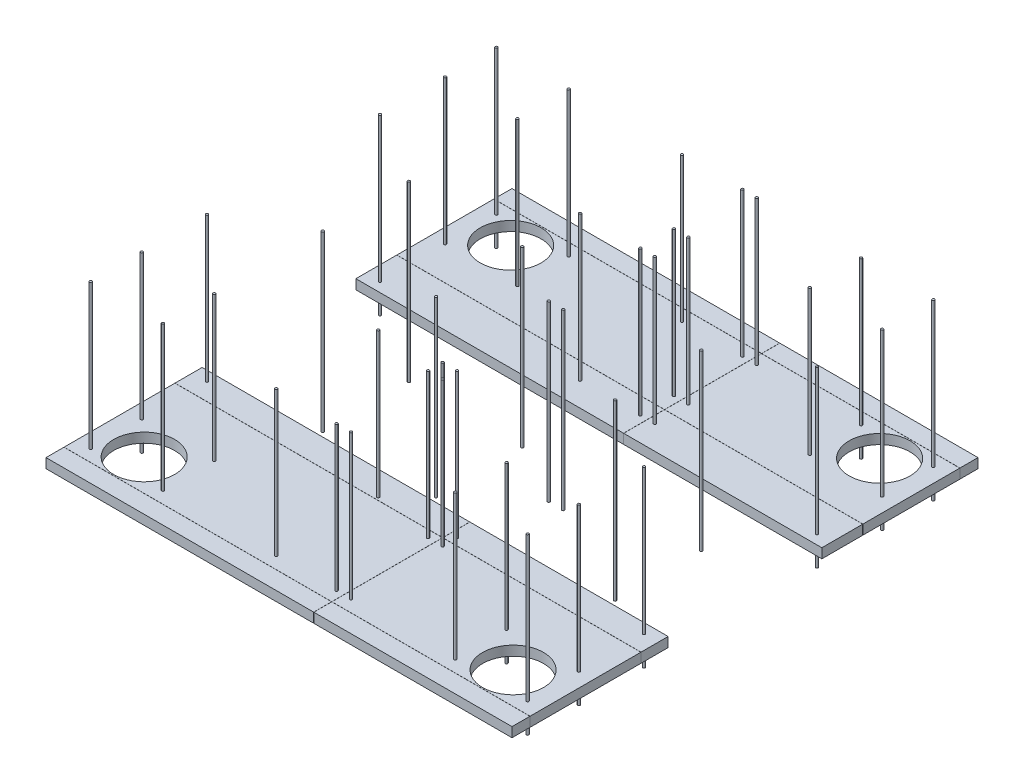
from build123d import *

# Parameters (mm, degrees)
SKETCH1_W                          = 4908.55
SKETCH1_H                          = 4908.55
BOSS_EXTRUDE1_DEPTH                = 101.6
SKETCH2_W                          = 4908.55
SKETCH2_H                          = 1619.25
CUT_EXTRUDE1_DEPTH                 = 3473.355700566
SKETCH4_W                          = 4908.55
SKETCH4_H                          = 1.27
CUT_EXTRUDE_THIN1_DEPTH            = 3473.355700566
CUT_EXTRUDE_THIN2_DEPTH            = 3473.355700566
CUT_EXTRUDE_THIN2_DEPTH_BACK       = 3473.355700566
SKETCH5_W                          = 1.27
SKETCH5_H                          = 4908.55
SKETCH6_R                          = 320.675
DUCT_HOLES_DEPTH                   = 3473.355700566
UNISTRUT_STUD_LAYOUT_DEPTH         = 1524
UNISTRUT_STUD_LAYOUT_DEPTH_BACK    = 304.8
SKETCH7_R                          = 12.7
UNISTRUT_STUD_LAYOUT_2_DEPTH       = 1524
UNISTRUT_STUD_LAYOUT_2_DEPTH_BACK  = 304.8
UNISTRUT_STUD_LAYOUT_3_DEPTH       = 1524
UNISTRUT_STUD_LAYOUT_3_DEPTH_BACK  = 304.8
UNISTRUT_STUD_LAYOUT_4_DEPTH       = 1524
UNISTRUT_STUD_LAYOUT_4_DEPTH_BACK  = 304.8
UNISTRUT_STUD_LAYOUT_5_DEPTH       = 1524
UNISTRUT_STUD_LAYOUT_5_DEPTH_BACK  = 304.8
UNISTRUT_STUD_LAYOUT_6_DEPTH       = 1524
UNISTRUT_STUD_LAYOUT_6_DEPTH_BACK  = 304.8
UNISTRUT_STUD_LAYOUT_7_DEPTH       = 1524
UNISTRUT_STUD_LAYOUT_7_DEPTH_BACK  = 304.8
UNISTRUT_STUD_LAYOUT_8_DEPTH       = 1524
UNISTRUT_STUD_LAYOUT_8_DEPTH_BACK  = 304.8
UNISTRUT_STUD_LAYOUT_9_DEPTH       = 1524
UNISTRUT_STUD_LAYOUT_9_DEPTH_BACK  = 304.8
UNISTRUT_STUD_LAYOUT_10_DEPTH      = 1524
UNISTRUT_STUD_LAYOUT_10_DEPTH_BACK = 304.8
UNISTRUT_STUD_LAYOUT_11_DEPTH      = 1524
UNISTRUT_STUD_LAYOUT_11_DEPTH_BACK = 304.8
UNISTRUT_STUD_LAYOUT_12_DEPTH      = 1524
UNISTRUT_STUD_LAYOUT_12_DEPTH_BACK = 304.8
UNISTRUT_STUD_LAYOUT_13_DEPTH      = 1524
UNISTRUT_STUD_LAYOUT_13_DEPTH_BACK = 304.8
UNISTRUT_STUD_LAYOUT_14_DEPTH      = 1524
UNISTRUT_STUD_LAYOUT_14_DEPTH_BACK = 304.8
UNISTRUT_STUD_LAYOUT_15_DEPTH      = 1524
UNISTRUT_STUD_LAYOUT_15_DEPTH_BACK = 304.8
UNISTRUT_STUD_LAYOUT_16_DEPTH      = 1524
UNISTRUT_STUD_LAYOUT_16_DEPTH_BACK = 304.8
UNISTRUT_STUD_LAYOUT_17_DEPTH      = 1524
UNISTRUT_STUD_LAYOUT_17_DEPTH_BACK = 304.8
UNISTRUT_STUD_LAYOUT_18_DEPTH      = 1524
UNISTRUT_STUD_LAYOUT_18_DEPTH_BACK = 304.8
UNISTRUT_STUD_LAYOUT_19_DEPTH      = 1524
UNISTRUT_STUD_LAYOUT_19_DEPTH_BACK = 304.8
UNISTRUT_STUD_LAYOUT_20_DEPTH      = 1524
UNISTRUT_STUD_LAYOUT_20_DEPTH_BACK = 304.8
UNISTRUT_STUD_LAYOUT_21_DEPTH      = 1524
UNISTRUT_STUD_LAYOUT_21_DEPTH_BACK = 304.8
UNISTRUT_STUD_LAYOUT_22_DEPTH      = 1524
UNISTRUT_STUD_LAYOUT_22_DEPTH_BACK = 304.8
UNISTRUT_STUD_LAYOUT_23_DEPTH      = 1524
UNISTRUT_STUD_LAYOUT_23_DEPTH_BACK = 304.8
UNISTRUT_STUD_LAYOUT_24_DEPTH      = 1524
UNISTRUT_STUD_LAYOUT_24_DEPTH_BACK = 304.8
UNISTRUT_STUD_LAYOUT_25_DEPTH      = 1524
UNISTRUT_STUD_LAYOUT_25_DEPTH_BACK = 304.8
UNISTRUT_STUD_LAYOUT_26_DEPTH      = 1524
UNISTRUT_STUD_LAYOUT_26_DEPTH_BACK = 304.8
UNISTRUT_STUD_LAYOUT_27_DEPTH      = 1524
UNISTRUT_STUD_LAYOUT_27_DEPTH_BACK = 304.8


with BuildPart() as part:
    # Sketch1 → Boss-Extrude1 (new body)
    with BuildSketch(Plane(origin=(0, 0, 0), x_dir=(1, 0, 0), z_dir=(0, 1, 0))):
        Rectangle(SKETCH1_W, SKETCH1_H)
    extrude(amount=BOSS_EXTRUDE1_DEPTH)

    # Sketch2 → Cut-Extrude1 (cut, through all)
    with BuildSketch(Plane(origin=(0, 101.6, 0), x_dir=(1, 0, 0), z_dir=(0, 1, 0))):
        Rectangle(SKETCH2_W, SKETCH2_H)
    extrude(amount=-CUT_EXTRUDE1_DEPTH, mode=Mode.SUBTRACT)


with BuildPart() as cut_extrude1_piece_1:
    # of the separate pieces the step leaves, piece 1, a body of its own (cut_extrude1_pieces)
    add(part.part.solids().sort_by_distance((-2454.275, 0, -2454.275))[0])


with BuildPart() as cut_extrude1_piece_2:
    # of the separate pieces the step leaves, piece 2, a body of its own (cut_extrude1_pieces)
    add(part.part.solids().sort_by_distance((-2454.275, 0, 2454.275))[0])


with BuildPart() as cut_extrude_thin1_tool:
    # Sketch4 → Cut-Extrude-Thin1 (new, through all)
    with BuildSketch(Plane(origin=(0, 101.6, 0), x_dir=(1, 0, 0), z_dir=(0, 1, 0))):
        with Locations((0, -2264.41)):
            Rectangle(SKETCH4_W, SKETCH4_H)
        with Locations((0, -1096.01)):
            Rectangle(SKETCH4_W, SKETCH4_H)
        with Locations((0, 2263.14)):
            Rectangle(SKETCH4_W, SKETCH4_H)
        with Locations((0, 1240.79)):
            Rectangle(SKETCH4_W, SKETCH4_H)
    extrude(amount=-CUT_EXTRUDE_THIN1_DEPTH)


with BuildPart() as cut_extrude1_piece_1_1:
    add(cut_extrude1_piece_1.part)

    # Cut-Extrude-Thin1: cut by cut_extrude_thin1_tool
    add(cut_extrude_thin1_tool.part, mode=Mode.SUBTRACT)


with BuildPart() as cut_extrude1_piece_2_1:
    add(cut_extrude1_piece_2.part)

    # Cut-Extrude-Thin1: cut by cut_extrude_thin1_tool
    add(cut_extrude_thin1_tool.part, mode=Mode.SUBTRACT)


with BuildPart() as cut_extrude_thin1_piece_1:
    # of the separate pieces the step leaves, piece 1, a body of its own (cut_extrude_thin1_pieces)
    add(cut_extrude1_piece_1_1.part.solids().sort_by_distance((-2454.275, 0, -1241.425))[0])


with BuildPart() as cut_extrude_thin1_piece_2:
    # of the separate pieces the step leaves, piece 2, a body of its own (cut_extrude_thin1_pieces)
    add(cut_extrude1_piece_1_1.part.solids().sort_by_distance((-2454.275, 0, -809.625))[0])


with BuildPart() as cut_extrude_thin1_piece_3:
    # of the separate pieces the step leaves, piece 3, a body of its own (cut_extrude_thin1_pieces)
    add(cut_extrude1_piece_1_1.part.solids().sort_by_distance((-2454.275, 0, -2454.275))[0])


with BuildPart() as cut_extrude_thin1_piece_1_of_cut_extrude:
    # of the separate pieces the step leaves, piece 1, a body of its own (cut_extrude_thin1_pieces_of_cut_extrude1)
    add(cut_extrude1_piece_2_1.part.solids().sort_by_distance((-2454.275, 0, 2263.775))[0])


with BuildPart() as cut_extrude_thin1_piece_2_of_cut_extrude:
    # of the separate pieces the step leaves, piece 2, a body of its own (cut_extrude_thin1_pieces_of_cut_extrude1)
    add(cut_extrude1_piece_2_1.part.solids().sort_by_distance((-2454.275, 0, 1095.375))[0])


with BuildPart() as cut_extrude_thin1_piece_3_of_cut_extrude:
    # of the separate pieces the step leaves, piece 3, a body of its own (cut_extrude_thin1_pieces_of_cut_extrude1)
    add(cut_extrude1_piece_2_1.part.solids().sort_by_distance((-2454.275, 0, 2454.275))[0])


with BuildPart() as cut_extrude_thin2_tool:
    # Sketch5 → Cut-Extrude-Thin2 (new, two sides: drawn at the far end of the back side and taken through both)
    with BuildSketch(Plane(origin=(0, 101.6, 0), x_dir=(1, 0, 0), z_dir=(0, 1, 0)).offset(-CUT_EXTRUDE_THIN2_DEPTH_BACK)):
        with Locations((365.76, 0)):
            Rectangle(SKETCH5_W, SKETCH5_H)
    extrude(amount=CUT_EXTRUDE_THIN2_DEPTH + CUT_EXTRUDE_THIN2_DEPTH_BACK)


with BuildPart() as cut_extrude_thin1_piece_1_1:
    add(cut_extrude_thin1_piece_1.part)

    # Cut-Extrude-Thin2: cut by cut_extrude_thin2_tool
    add(cut_extrude_thin2_tool.part, mode=Mode.SUBTRACT)


with BuildPart() as cut_extrude_thin1_piece_2_1:
    add(cut_extrude_thin1_piece_2.part)

    # Cut-Extrude-Thin2: cut by cut_extrude_thin2_tool
    add(cut_extrude_thin2_tool.part, mode=Mode.SUBTRACT)


with BuildPart() as cut_extrude_thin1_piece_3_1:
    add(cut_extrude_thin1_piece_3.part)

    # Cut-Extrude-Thin2: cut by cut_extrude_thin2_tool
    add(cut_extrude_thin2_tool.part, mode=Mode.SUBTRACT)


with BuildPart() as cut_extrude_thin1_piece_1_of_cut_extrude_1:
    add(cut_extrude_thin1_piece_1_of_cut_extrude.part)

    # Cut-Extrude-Thin2: cut by cut_extrude_thin2_tool
    add(cut_extrude_thin2_tool.part, mode=Mode.SUBTRACT)


with BuildPart() as cut_extrude_thin1_piece_2_of_cut_extrude_1:
    add(cut_extrude_thin1_piece_2_of_cut_extrude.part)

    # Cut-Extrude-Thin2: cut by cut_extrude_thin2_tool
    add(cut_extrude_thin2_tool.part, mode=Mode.SUBTRACT)


with BuildPart() as cut_extrude_thin1_piece_3_of_cut_extrude_1:
    add(cut_extrude_thin1_piece_3_of_cut_extrude.part)

    # Cut-Extrude-Thin2: cut by cut_extrude_thin2_tool
    add(cut_extrude_thin2_tool.part, mode=Mode.SUBTRACT)


with BuildPart() as cut_extrude_thin2_piece_1:
    # of the separate pieces the step leaves, piece 1, a body of its own (cut_extrude_thin2_pieces)
    add(cut_extrude_thin1_piece_1_1.part.solids().sort_by_distance((-2454.275, 0, -1241.425))[0])


with BuildPart() as cut_extrude_thin2_piece_2:
    # of the separate pieces the step leaves, piece 2, a body of its own (cut_extrude_thin2_pieces)
    add(cut_extrude_thin1_piece_1_1.part.solids().sort_by_distance((2454.275, 0, -2262.505))[0])


with BuildPart() as cut_extrude_thin2_piece_1_of_cut_extrude:
    # of the separate pieces the step leaves, piece 1, a body of its own (cut_extrude_thin2_pieces_of_cut_extrude)
    add(cut_extrude_thin1_piece_2_1.part.solids().sort_by_distance((-2454.275, 0, -809.625))[0])


with BuildPart() as cut_extrude_thin2_piece_2_of_cut_extrude:
    # of the separate pieces the step leaves, piece 2, a body of its own (cut_extrude_thin2_pieces_of_cut_extrude)
    add(cut_extrude_thin1_piece_2_1.part.solids().sort_by_distance((2454.275, 0, -1240.155))[0])


with BuildPart() as cut_extrude_thin2_piece_1_of_cut_ext_2:
    # of the separate pieces the step leaves, piece 1, a body of its own (cut_extrude_thin2_pieces_of_cut_extr_2)
    add(cut_extrude_thin1_piece_3_1.part.solids().sort_by_distance((-2454.275, 0, -2454.275))[0])


with BuildPart() as cut_extrude_thin2_piece_2_of_cut_ext_2:
    # of the separate pieces the step leaves, piece 2, a body of its own (cut_extrude_thin2_pieces_of_cut_extr_2)
    add(cut_extrude_thin1_piece_3_1.part.solids().sort_by_distance((366.395, 0, -2454.275))[0])


with BuildPart() as cut_extrude_thin2_piece_1_of_cut_ext_3:
    # of the separate pieces the step leaves, piece 1, a body of its own (cut_extrude_thin2_pieces_of_cut_extr_3)
    add(cut_extrude_thin1_piece_1_of_cut_extrude_1.part.solids().sort_by_distance((-2454.275, 0, 2263.775))[0])


with BuildPart() as cut_extrude_thin2_piece_2_of_cut_ext_3:
    # of the separate pieces the step leaves, piece 2, a body of its own (cut_extrude_thin2_pieces_of_cut_extr_3)
    add(cut_extrude_thin1_piece_1_of_cut_extrude_1.part.solids().sort_by_distance((2454.275, 0, 1096.645))[0])


with BuildPart() as cut_extrude_thin2_piece_1_of_cut_ext_4:
    # of the separate pieces the step leaves, piece 1, a body of its own (cut_extrude_thin2_pieces_of_cut_extr_4)
    add(cut_extrude_thin1_piece_2_of_cut_extrude_1.part.solids().sort_by_distance((-2454.275, 0, 1095.375))[0])


with BuildPart() as cut_extrude_thin2_piece_2_of_cut_ext_4:
    # of the separate pieces the step leaves, piece 2, a body of its own (cut_extrude_thin2_pieces_of_cut_extr_4)
    add(cut_extrude_thin1_piece_2_of_cut_extrude_1.part.solids().sort_by_distance((2454.275, 0, 809.625))[0])


with BuildPart() as cut_extrude_thin2_piece_1_of_cut_ext_5:
    # of the separate pieces the step leaves, piece 1, a body of its own (cut_extrude_thin2_pieces_of_cut_extr_5)
    add(cut_extrude_thin1_piece_3_of_cut_extrude_1.part.solids().sort_by_distance((-2454.275, 0, 2454.275))[0])


with BuildPart() as cut_extrude_thin2_piece_2_of_cut_ext_5:
    # of the separate pieces the step leaves, piece 2, a body of its own (cut_extrude_thin2_pieces_of_cut_extr_5)
    add(cut_extrude_thin1_piece_3_of_cut_extrude_1.part.solids().sort_by_distance((2454.275, 0, 2265.045))[0])


with BuildPart() as duct_holes_tool:
    # Sketch6 → DUCT HOLES (new, through all)
    with BuildSketch(Plane(origin=(0, 101.6, 0), x_dir=(1, 0, 0), z_dir=(0, 1, 0))):
        with Locations((1943.1, 1929.13)):
            Circle(SKETCH6_R)
        with Locations((-1943.1, 1929.13)):
            Circle(SKETCH6_R)
        with Locations((-1943.1, -1931.67)):
            Circle(SKETCH6_R)
        with Locations((1943.1, -1931.67)):
            Circle(SKETCH6_R)
    extrude(amount=-DUCT_HOLES_DEPTH)


with BuildPart() as cut_extrude_thin2_piece_1_1:
    add(cut_extrude_thin2_piece_1.part)

    # DUCT HOLES: cut by duct_holes_tool
    add(duct_holes_tool.part, mode=Mode.SUBTRACT)


with BuildPart() as cut_extrude_thin2_piece_2_1:
    add(cut_extrude_thin2_piece_2.part)

    # DUCT HOLES: cut by duct_holes_tool
    add(duct_holes_tool.part, mode=Mode.SUBTRACT)


with BuildPart() as cut_extrude_thin2_piece_1_of_cut_ext_3_1:
    add(cut_extrude_thin2_piece_1_of_cut_ext_3.part)

    # DUCT HOLES: cut by duct_holes_tool
    add(duct_holes_tool.part, mode=Mode.SUBTRACT)


with BuildPart() as cut_extrude_thin2_piece_2_of_cut_ext_3_1:
    add(cut_extrude_thin2_piece_2_of_cut_ext_3.part)

    # DUCT HOLES: cut by duct_holes_tool
    add(duct_holes_tool.part, mode=Mode.SUBTRACT)


with BuildPart() as body_13:
    # Sketch7 → UNISTRUT STUD LAYOUT (new, two sides: drawn at the far end of the back side and taken through both)
    with BuildSketch(Plane(origin=(0, 101.6, 0), x_dir=(1, 0, 0), z_dir=(0, 1, 0)).offset(-UNISTRUT_STUD_LAYOUT_DEPTH_BACK)):
        with Locations((1539.875, 1597.025)):
            Circle(SKETCH7_R)
    extrude(amount=UNISTRUT_STUD_LAYOUT_DEPTH + UNISTRUT_STUD_LAYOUT_DEPTH_BACK)


with BuildPart() as body_14:
    # Sketch7 → UNISTRUT STUD LAYOUT 2 (new, two sides: drawn at the far end of the back side and taken through both)
    with BuildSketch(Plane(origin=(0, 101.6, 0), x_dir=(1, 0, 0), z_dir=(0, 1, 0)).offset(-UNISTRUT_STUD_LAYOUT_2_DEPTH_BACK)):
        with Locations((-1539.875, 1597.025)):
            Circle(SKETCH7_R)
    extrude(amount=UNISTRUT_STUD_LAYOUT_2_DEPTH + UNISTRUT_STUD_LAYOUT_2_DEPTH_BACK)


with BuildPart() as body_15:
    # Sketch7 → UNISTRUT STUD LAYOUT 3 (new, two sides: drawn at the far end of the back side and taken through both)
    with BuildSketch(Plane(origin=(0, 101.6, 0), x_dir=(1, 0, 0), z_dir=(0, 1, 0)).offset(-UNISTRUT_STUD_LAYOUT_3_DEPTH_BACK)):
        with Locations((441.325, 1063.625)):
            Circle(SKETCH7_R)
    extrude(amount=UNISTRUT_STUD_LAYOUT_3_DEPTH + UNISTRUT_STUD_LAYOUT_3_DEPTH_BACK)


with BuildPart() as body_16:
    # Sketch7 → UNISTRUT STUD LAYOUT 4 (new, two sides: drawn at the far end of the back side and taken through both)
    with BuildSketch(Plane(origin=(0, 101.6, 0), x_dir=(1, 0, 0), z_dir=(0, 1, 0)).offset(-UNISTRUT_STUD_LAYOUT_4_DEPTH_BACK)):
        with Locations((-346.075, 2136.775)):
            Circle(SKETCH7_R)
    extrude(amount=UNISTRUT_STUD_LAYOUT_4_DEPTH + UNISTRUT_STUD_LAYOUT_4_DEPTH_BACK)


with BuildPart() as body_17:
    # Sketch7 → UNISTRUT STUD LAYOUT 5 (new, two sides: drawn at the far end of the back side and taken through both)
    with BuildSketch(Plane(origin=(0, 101.6, 0), x_dir=(1, 0, 0), z_dir=(0, 1, 0)).offset(-UNISTRUT_STUD_LAYOUT_5_DEPTH_BACK)):
        with Locations((-1539.875, 2136.775)):
            Circle(SKETCH7_R)
    extrude(amount=UNISTRUT_STUD_LAYOUT_5_DEPTH + UNISTRUT_STUD_LAYOUT_5_DEPTH_BACK)


with BuildPart() as body_18:
    # Sketch7 → UNISTRUT STUD LAYOUT 6 (new, two sides: drawn at the far end of the back side and taken through both)
    with BuildSketch(Plane(origin=(0, 101.6, 0), x_dir=(1, 0, 0), z_dir=(0, 1, 0)).offset(-UNISTRUT_STUD_LAYOUT_6_DEPTH_BACK)):
        with Locations((1539.875, 2136.775)):
            Circle(SKETCH7_R)
    extrude(amount=UNISTRUT_STUD_LAYOUT_6_DEPTH + UNISTRUT_STUD_LAYOUT_6_DEPTH_BACK)


with BuildPart() as body_19:
    # Sketch7 → UNISTRUT STUD LAYOUT 7 (new, two sides: drawn at the far end of the back side and taken through both)
    with BuildSketch(Plane(origin=(0, 101.6, 0), x_dir=(1, 0, 0), z_dir=(0, 1, 0)).offset(-UNISTRUT_STUD_LAYOUT_7_DEPTH_BACK)):
        with Locations((-346.075, 1063.625)):
            Circle(SKETCH7_R)
    extrude(amount=UNISTRUT_STUD_LAYOUT_7_DEPTH + UNISTRUT_STUD_LAYOUT_7_DEPTH_BACK)


with BuildPart() as body_20:
    # Sketch7 → UNISTRUT STUD LAYOUT 8 (new, two sides: drawn at the far end of the back side and taken through both)
    with BuildSketch(Plane(origin=(0, 101.6, 0), x_dir=(1, 0, 0), z_dir=(0, 1, 0)).offset(-UNISTRUT_STUD_LAYOUT_8_DEPTH_BACK)):
        with Locations((-2301.875, 1597.025)):
            Circle(SKETCH7_R)
    extrude(amount=UNISTRUT_STUD_LAYOUT_8_DEPTH + UNISTRUT_STUD_LAYOUT_8_DEPTH_BACK)


with BuildPart() as body_21:
    # Sketch7 → UNISTRUT STUD LAYOUT 9 (new, two sides: drawn at the far end of the back side and taken through both)
    with BuildSketch(Plane(origin=(0, 101.6, 0), x_dir=(1, 0, 0), z_dir=(0, 1, 0)).offset(-UNISTRUT_STUD_LAYOUT_9_DEPTH_BACK)):
        with Locations((2301.875, 1597.025)):
            Circle(SKETCH7_R)
    extrude(amount=UNISTRUT_STUD_LAYOUT_9_DEPTH + UNISTRUT_STUD_LAYOUT_9_DEPTH_BACK)


with BuildPart() as body_22:
    # Sketch7 → UNISTRUT STUD LAYOUT 10 (new, two sides: drawn at the far end of the back side and taken through both)
    with BuildSketch(Plane(origin=(0, 101.6, 0), x_dir=(1, 0, 0), z_dir=(0, 1, 0)).offset(-UNISTRUT_STUD_LAYOUT_10_DEPTH_BACK)):
        with Locations((-2301.875, 2136.775)):
            Circle(SKETCH7_R)
    extrude(amount=UNISTRUT_STUD_LAYOUT_10_DEPTH + UNISTRUT_STUD_LAYOUT_10_DEPTH_BACK)


with BuildPart() as body_23:
    # Sketch7 → UNISTRUT STUD LAYOUT 11 (new, two sides: drawn at the far end of the back side and taken through both)
    with BuildSketch(Plane(origin=(0, 101.6, 0), x_dir=(1, 0, 0), z_dir=(0, 1, 0)).offset(-UNISTRUT_STUD_LAYOUT_11_DEPTH_BACK)):
        with Locations((2301.875, 2136.775)):
            Circle(SKETCH7_R)
    extrude(amount=UNISTRUT_STUD_LAYOUT_11_DEPTH + UNISTRUT_STUD_LAYOUT_11_DEPTH_BACK)


with BuildPart() as body_24:
    # Sketch7 → UNISTRUT STUD LAYOUT 12 (new, two sides: drawn at the far end of the back side and taken through both)
    with BuildSketch(Plane(origin=(0, 101.6, 0), x_dir=(1, 0, 0), z_dir=(0, 1, 0)).offset(-UNISTRUT_STUD_LAYOUT_12_DEPTH_BACK)):
        with Locations((288.925, 1416.685)):
            Circle(SKETCH7_R)
    extrude(amount=UNISTRUT_STUD_LAYOUT_12_DEPTH + UNISTRUT_STUD_LAYOUT_12_DEPTH_BACK)


with BuildPart() as body_25:
    # Sketch7 → UNISTRUT STUD LAYOUT 13 (new, two sides: drawn at the far end of the back side and taken through both)
    with BuildSketch(Plane(origin=(0, 101.6, 0), x_dir=(1, 0, 0), z_dir=(0, 1, 0)).offset(-UNISTRUT_STUD_LAYOUT_13_DEPTH_BACK)):
        with Locations((441.325, 1416.685)):
            Circle(SKETCH7_R)
    extrude(amount=UNISTRUT_STUD_LAYOUT_13_DEPTH + UNISTRUT_STUD_LAYOUT_13_DEPTH_BACK)


with BuildPart() as body_26:
    # Sketch7 → UNISTRUT STUD LAYOUT 14 (new, two sides: drawn at the far end of the back side and taken through both)
    with BuildSketch(Plane(origin=(0, 101.6, 0), x_dir=(1, 0, 0), z_dir=(0, 1, 0)).offset(-UNISTRUT_STUD_LAYOUT_14_DEPTH_BACK)):
        with Locations((288.925, 1063.625)):
            Circle(SKETCH7_R)
    extrude(amount=UNISTRUT_STUD_LAYOUT_14_DEPTH + UNISTRUT_STUD_LAYOUT_14_DEPTH_BACK)


with BuildPart() as body_27:
    # Sketch7 → UNISTRUT STUD LAYOUT 15 (new, two sides: drawn at the far end of the back side and taken through both)
    with BuildSketch(Plane(origin=(0, 101.6, 0), x_dir=(1, 0, 0), z_dir=(0, 1, 0)).offset(-UNISTRUT_STUD_LAYOUT_15_DEPTH_BACK)):
        with Locations((441.325, -1020.445)):
            Circle(SKETCH7_R)
    extrude(amount=UNISTRUT_STUD_LAYOUT_15_DEPTH + UNISTRUT_STUD_LAYOUT_15_DEPTH_BACK)


with BuildPart() as body_28:
    # Sketch7 → UNISTRUT STUD LAYOUT 16 (new, two sides: drawn at the far end of the back side and taken through both)
    with BuildSketch(Plane(origin=(0, 101.6, 0), x_dir=(1, 0, 0), z_dir=(0, 1, 0)).offset(-UNISTRUT_STUD_LAYOUT_16_DEPTH_BACK)):
        with Locations((288.925, -1020.445)):
            Circle(SKETCH7_R)
    extrude(amount=UNISTRUT_STUD_LAYOUT_16_DEPTH + UNISTRUT_STUD_LAYOUT_16_DEPTH_BACK)


with BuildPart() as body_29:
    # Sketch7 → UNISTRUT STUD LAYOUT 17 (new, two sides: drawn at the far end of the back side and taken through both)
    with BuildSketch(Plane(origin=(0, 101.6, 0), x_dir=(1, 0, 0), z_dir=(0, 1, 0)).offset(-UNISTRUT_STUD_LAYOUT_17_DEPTH_BACK)):
        with Locations((288.925, -1172.845)):
            Circle(SKETCH7_R)
    extrude(amount=UNISTRUT_STUD_LAYOUT_17_DEPTH + UNISTRUT_STUD_LAYOUT_17_DEPTH_BACK)


with BuildPart() as body_30:
    # Sketch7 → UNISTRUT STUD LAYOUT 18 (new, two sides: drawn at the far end of the back side and taken through both)
    with BuildSketch(Plane(origin=(0, 101.6, 0), x_dir=(1, 0, 0), z_dir=(0, 1, 0)).offset(-UNISTRUT_STUD_LAYOUT_18_DEPTH_BACK)):
        with Locations((441.325, -1172.845)):
            Circle(SKETCH7_R)
    extrude(amount=UNISTRUT_STUD_LAYOUT_18_DEPTH + UNISTRUT_STUD_LAYOUT_18_DEPTH_BACK)


with BuildPart() as body_31:
    # Sketch7 → UNISTRUT STUD LAYOUT 19 (new, two sides: drawn at the far end of the back side and taken through both)
    with BuildSketch(Plane(origin=(0, 101.6, 0), x_dir=(1, 0, 0), z_dir=(0, 1, 0)).offset(-UNISTRUT_STUD_LAYOUT_19_DEPTH_BACK)):
        with Locations((-2301.875, 911.225)):
            Circle(SKETCH7_R)
    extrude(amount=UNISTRUT_STUD_LAYOUT_19_DEPTH + UNISTRUT_STUD_LAYOUT_19_DEPTH_BACK)


with BuildPart() as body_32:
    # Sketch7 → UNISTRUT STUD LAYOUT 20 (new, two sides: drawn at the far end of the back side and taken through both)
    with BuildSketch(Plane(origin=(0, 101.6, 0), x_dir=(1, 0, 0), z_dir=(0, 1, 0)).offset(-UNISTRUT_STUD_LAYOUT_20_DEPTH_BACK)):
        with Locations((2301.875, 911.225)):
            Circle(SKETCH7_R)
    extrude(amount=UNISTRUT_STUD_LAYOUT_20_DEPTH + UNISTRUT_STUD_LAYOUT_20_DEPTH_BACK)


with BuildPart() as body_33:
    # Sketch7 → UNISTRUT STUD LAYOUT 21 (new, two sides: drawn at the far end of the back side and taken through both)
    with BuildSketch(Plane(origin=(0, 101.6, 0), x_dir=(1, 0, 0), z_dir=(0, 1, 0)).offset(-UNISTRUT_STUD_LAYOUT_21_DEPTH_BACK)):
        with Locations((1539.875, 454.025)):
            Circle(SKETCH7_R)
    extrude(amount=UNISTRUT_STUD_LAYOUT_21_DEPTH + UNISTRUT_STUD_LAYOUT_21_DEPTH_BACK)


with BuildPart() as body_34:
    # Sketch7 → UNISTRUT STUD LAYOUT 22 (new, two sides: drawn at the far end of the back side and taken through both)
    with BuildSketch(Plane(origin=(0, 101.6, 0), x_dir=(1, 0, 0), z_dir=(0, 1, 0)).offset(-UNISTRUT_STUD_LAYOUT_22_DEPTH_BACK)):
        with Locations((-1539.875, 454.025)):
            Circle(SKETCH7_R)
    extrude(amount=UNISTRUT_STUD_LAYOUT_22_DEPTH + UNISTRUT_STUD_LAYOUT_22_DEPTH_BACK)


with BuildPart() as body_35:
    # Sketch7 → UNISTRUT STUD LAYOUT 23 (new, two sides: drawn at the far end of the back side and taken through both)
    with BuildSketch(Plane(origin=(0, 101.6, 0), x_dir=(1, 0, 0), z_dir=(0, 1, 0)).offset(-UNISTRUT_STUD_LAYOUT_23_DEPTH_BACK)):
        with Locations((-346.075, 454.025)):
            Circle(SKETCH7_R)
    extrude(amount=UNISTRUT_STUD_LAYOUT_23_DEPTH + UNISTRUT_STUD_LAYOUT_23_DEPTH_BACK)


with BuildPart() as body_36:
    # Sketch7 → UNISTRUT STUD LAYOUT 24 (new, two sides: drawn at the far end of the back side and taken through both)
    with BuildSketch(Plane(origin=(0, 101.6, 0), x_dir=(1, 0, 0), z_dir=(0, 1, 0)).offset(-UNISTRUT_STUD_LAYOUT_24_DEPTH_BACK)):
        with Locations((441.325, 98.425)):
            Circle(SKETCH7_R)
    extrude(amount=UNISTRUT_STUD_LAYOUT_24_DEPTH + UNISTRUT_STUD_LAYOUT_24_DEPTH_BACK)


with BuildPart() as body_37:
    # Sketch7 → UNISTRUT STUD LAYOUT 25 (new, two sides: drawn at the far end of the back side and taken through both)
    with BuildSketch(Plane(origin=(0, 101.6, 0), x_dir=(1, 0, 0), z_dir=(0, 1, 0)).offset(-UNISTRUT_STUD_LAYOUT_25_DEPTH_BACK)):
        with Locations((288.925, 98.425)):
            Circle(SKETCH7_R)
    extrude(amount=UNISTRUT_STUD_LAYOUT_25_DEPTH + UNISTRUT_STUD_LAYOUT_25_DEPTH_BACK)


with BuildPart() as body_38:
    # Sketch7 → UNISTRUT STUD LAYOUT 26 (new, two sides: drawn at the far end of the back side and taken through both)
    with BuildSketch(Plane(origin=(0, 101.6, 0), x_dir=(1, 0, 0), z_dir=(0, 1, 0)).offset(-UNISTRUT_STUD_LAYOUT_26_DEPTH_BACK)):
        with Locations((288.925, 2136.775)):
            Circle(SKETCH7_R)
    extrude(amount=UNISTRUT_STUD_LAYOUT_26_DEPTH + UNISTRUT_STUD_LAYOUT_26_DEPTH_BACK)


with BuildPart() as body_39:
    # Sketch7 → UNISTRUT STUD LAYOUT 27 (new, two sides: drawn at the far end of the back side and taken through both)
    with BuildSketch(Plane(origin=(0, 101.6, 0), x_dir=(1, 0, 0), z_dir=(0, 1, 0)).offset(-UNISTRUT_STUD_LAYOUT_27_DEPTH_BACK)):
        with Locations((441.325, 2136.775)):
            Circle(SKETCH7_R)
    extrude(amount=UNISTRUT_STUD_LAYOUT_27_DEPTH + UNISTRUT_STUD_LAYOUT_27_DEPTH_BACK)


with BuildPart() as body_40:
    # Mirror3: mirrored copy
    add(body_20.part.mirror(Plane.XY))


with BuildPart() as body_41:
    # Mirror3 2: mirrored copy
    add(body_14.part.mirror(Plane.XY))


with BuildPart() as body_42:
    # Mirror3 3: mirrored copy
    add(body_17.part.mirror(Plane.XY))


with BuildPart() as body_43:
    # Mirror3 4: mirrored copy
    add(body_19.part.mirror(Plane.XY))


with BuildPart() as body_44:
    # Mirror3 5: mirrored copy
    add(body_16.part.mirror(Plane.XY))


with BuildPart() as body_45:
    # Mirror3 6: mirrored copy
    add(body_13.part.mirror(Plane.XY))


with BuildPart() as body_46:
    # Mirror3 7: mirrored copy
    add(body_18.part.mirror(Plane.XY))


with BuildPart() as body_47:
    # Mirror3 8: mirrored copy
    add(body_21.part.mirror(Plane.XY))


with BuildPart() as body_48:
    # Mirror3 9: mirrored copy
    add(body_22.part.mirror(Plane.XY))


with BuildPart() as body_49:
    # Mirror3 10: mirrored copy
    add(body_23.part.mirror(Plane.XY))


with BuildPart() as body_50:
    # Mirror3 11: mirrored copy
    add(body_32.part.mirror(Plane.XY))


with BuildPart() as body_51:
    # Mirror3 12: mirrored copy
    add(body_31.part.mirror(Plane.XY))


with BuildPart() as body_52:
    # Mirror3 13: mirrored copy
    add(body_34.part.mirror(Plane.XY))


with BuildPart() as body_53:
    # Mirror3 14: mirrored copy
    add(body_35.part.mirror(Plane.XY))


with BuildPart() as body_54:
    # Mirror3 15: mirrored copy
    add(body_33.part.mirror(Plane.XY))


with BuildPart() as body_55:
    # Mirror3 16: mirrored copy
    add(body_38.part.mirror(Plane.XY))


with BuildPart() as body_56:
    # Mirror3 17: mirrored copy
    add(body_39.part.mirror(Plane.XY))


solid = Compound([cut_extrude_thin2_piece_1_of_cut_extrude.part, cut_extrude_thin2_piece_2_of_cut_extrude.part, cut_extrude_thin2_piece_1_of_cut_ext_2.part, cut_extrude_thin2_piece_2_of_cut_ext_2.part, cut_extrude_thin2_piece_1_of_cut_ext_4.part, cut_extrude_thin2_piece_2_of_cut_ext_4.part, cut_extrude_thin2_piece_1_of_cut_ext_5.part, cut_extrude_thin2_piece_2_of_cut_ext_5.part, cut_extrude_thin2_piece_1_1.part, cut_extrude_thin2_piece_2_1.part, cut_extrude_thin2_piece_1_of_cut_ext_3_1.part, cut_extrude_thin2_piece_2_of_cut_ext_3_1.part, body_13.part, body_14.part, body_15.part, body_16.part, body_17.part, body_18.part, body_19.part, body_20.part, body_21.part, body_22.part, body_23.part, body_24.part, body_25.part, body_26.part, body_27.part, body_28.part, body_29.part, body_30.part, body_31.part, body_32.part, body_33.part, body_34.part, body_35.part, body_36.part, body_37.part, body_38.part, body_39.part, body_40.part, body_41.part, body_42.part, body_43.part, body_44.part, body_45.part, body_46.part, body_47.part, body_48.part, body_49.part, body_50.part, body_51.part, body_52.part, body_53.part, body_54.part, body_55.part, body_56.part])
